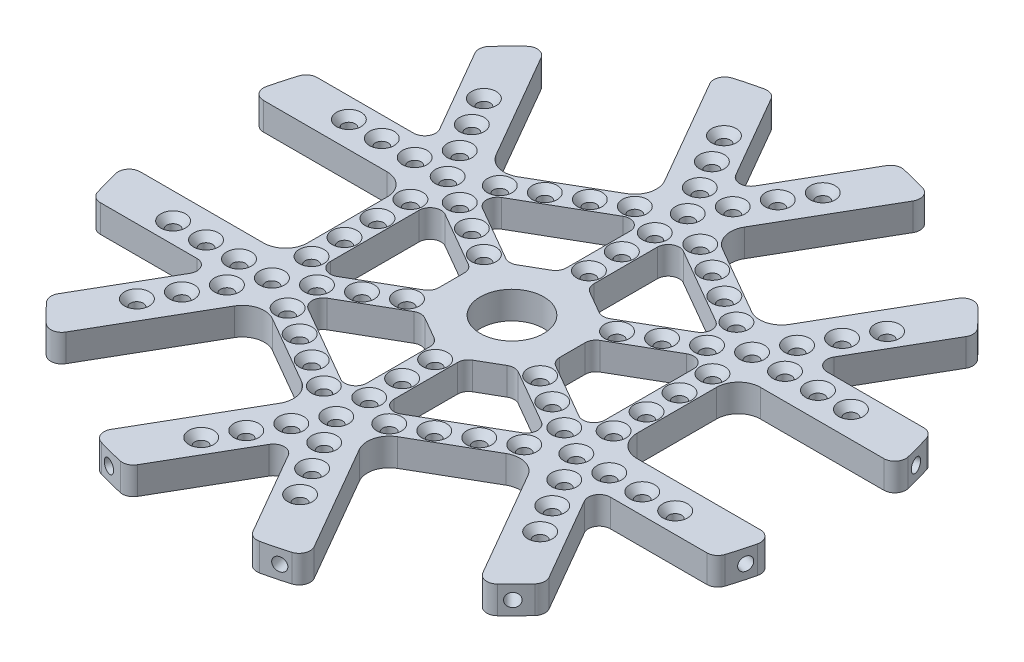
from build123d import *

# Parameters (mm, degrees)
BOSS_EXTRUDE1_DEPTH                           = 6.35
CIRPATTERN9_COUNT                             = 6
BOSS_EXTRUDE2_DEPTH                           = 6.35
SKETCH5_R                                     = 6.35
CUT_EXTRUDE1_DEPTH                            = 6.35
BOSS_EXTRUDE3_DEPTH                           = 6.35
CIRPATTERN10_COUNT                            = 6
CUT_EXTRUDE3_DEPTH                            = 7.62
FILLET5_R                                     = 2.54
FILLET6_R                                     = 5.08
CSK_FOR_4_FLAT_HEAD_MACHINE_SCREW1_AT_2_COUNT = 2
CSK_FOR_4_FLAT_HEAD_MACHINE_SCREW1_AT_2_PITCH = 7.620000000000001
CSK_FOR_4_FLAT_HEAD_MACHINE_SCREW1_AT_3_COUNT = 2
CSK_FOR_4_FLAT_HEAD_MACHINE_SCREW1_AT_3_PITCH = 15.240000000000006
CSK_FOR_4_FLAT_HEAD_MACHINE_SCREW1_AT_4_COUNT = 2
CSK_FOR_4_FLAT_HEAD_MACHINE_SCREW1_AT_4_PITCH = 22.860000000000003
CIRPATTERN11_COUNT                            = 6
CSK_FOR_4_FLAT_HEAD_MACHINE_SCREW2_AT_2_COUNT = 2
CSK_FOR_4_FLAT_HEAD_MACHINE_SCREW2_AT_2_PITCH = 15.240000000000002
CSK_FOR_4_FLAT_HEAD_MACHINE_SCREW2_AT_3_COUNT = 2
CSK_FOR_4_FLAT_HEAD_MACHINE_SCREW2_AT_3_PITCH = 7.6200000000000045
CIRPATTERN12_COUNT                            = 6
CSK_FOR_4_FLAT_HEAD_MACHINE_SCREW3_AT_2_COUNT = 2
CSK_FOR_4_FLAT_HEAD_MACHINE_SCREW3_AT_2_PITCH = 7.6199999999999966
CSK_FOR_4_FLAT_HEAD_MACHINE_SCREW3_AT_3_COUNT = 2
CSK_FOR_4_FLAT_HEAD_MACHINE_SCREW3_AT_3_PITCH = 15.239999999999997
CSK_FOR_4_FLAT_HEAD_MACHINE_SCREW3_AT_4_COUNT = 2
CSK_FOR_4_FLAT_HEAD_MACHINE_SCREW3_AT_4_PITCH = 22.859999999999996
CIRPATTERN13_COUNT                            = 6
SKETCH30_R                                    = 6.35
BOSS_EXTRUDE4_DEPTH                           = 6.35
F_9_16_CLEARANCE_HOLE1_D                      = 14.68374
CIRPATTERN14_COUNT                            = 12


with BuildPart() as part:
    # Sketch1 → Boss-Extrude1 (new body)
    with BuildSketch(Plane(origin=(0, 0, 0), x_dir=(1, 0, 0), z_dir=(0, 1, 0))):
        with BuildLine():
            Line((0, 50.13282258762273), (-14.27141129381163, 74.85163204421708))
            ThreePointArc((-14.27141129381163, 74.8516320442171), (-19.722011236812126, 73.60354796322702), (-25.066411293811605, 71.95912051192309))
            Line((-25.066411293811612, 71.95912051192312), (-3.1750000000000043, 34.04208390165379))
            Line((-3.175, 34.04208390165379), (-3.175, -3.9e-16))
            Line((-3.175, -3.9e-16), (0, 0))
            Line((0, 0), (2e-16, 50.13282258762273))
        make_face()
    boss_extrude1 = extrude(amount=BOSS_EXTRUDE1_DEPTH)

    # Mirror1: Boss-Extrude1 across Right Plane
    add(boss_extrude1.mirror(Plane(origin=(0, 0, 0), x_dir=(0, 0, -1), z_dir=(1, 0, 0))))


with BuildPart() as cirpattern9_1:
    # CirPattern9: pattern copy
    add(part.part.rotate(Axis((4.3e-16, 0, 8.8e-16), (0, 1, 0)), 1 * 360 / CIRPATTERN9_COUNT))


with BuildPart() as cirpattern9_2:
    # CirPattern9: pattern copy
    add(part.part.rotate(Axis((4.3e-16, 0, 8.8e-16), (0, 1, 0)), 2 * 360 / CIRPATTERN9_COUNT))


with BuildPart() as cirpattern9_3:
    # CirPattern9: pattern copy
    add(part.part.rotate(Axis((4.3e-16, 0, 8.8e-16), (0, 1, 0)), 3 * 360 / CIRPATTERN9_COUNT))


with BuildPart() as cirpattern9_4:
    # CirPattern9: pattern copy
    add(part.part.rotate(Axis((4.3e-16, 0, 8.8e-16), (0, 1, 0)), 4 * 360 / CIRPATTERN9_COUNT))


with BuildPart() as cirpattern9_5:
    # CirPattern9: pattern copy
    add(part.part.rotate(Axis((4.3e-16, 0, 8.8e-16), (0, 1, 0)), 5 * 360 / CIRPATTERN9_COUNT))


with BuildPart() as part_1:
    add(part.part)

    add(cirpattern9_1.part)  # Boss-Extrude2 merges CirPattern9_1

    add(cirpattern9_2.part)  # Boss-Extrude2 merges CirPattern9_2

    add(cirpattern9_3.part)  # Boss-Extrude2 merges CirPattern9_3

    add(cirpattern9_4.part)  # Boss-Extrude2 merges CirPattern9_4

    add(cirpattern9_5.part)  # Boss-Extrude2 merges CirPattern9_5
    # Sketch4 → Boss-Extrude2 (add)
    with BuildSketch(Plane(origin=(0, 6.35, 0), x_dir=(1, 0, 0), z_dir=(0, 1, 0))):
        Polygon((1.73e-15, 16.131166521158146), (-13.97, 8.065583260579077), (-13.97, -8.06558326057907), (-1.36e-15, -16.131166521158146), (13.97, -8.065583260579077), (13.97, 8.065583260579075), align=None)
    extrude(amount=-BOSS_EXTRUDE2_DEPTH)

    # Sketch5 → Cut-Extrude1 (cut)
    with BuildSketch(Plane(origin=(0, 6.35, 0), x_dir=(1, 0, 0), z_dir=(0, 1, 0))):
        with Locations(Location((0, 0, 0), (0, 0, 270))):
            Circle(SKETCH5_R)
    extrude(amount=-CUT_EXTRUDE1_DEPTH, mode=Mode.SUBTRACT)

    # Sketch6 → Boss-Extrude3 (add)
    with BuildSketch(Plane(origin=(0, 6.35, 0), x_dir=(1, 0, 0), z_dir=(0, 1, 0))):
        Polygon((-28.794525284181248, 20.037215169531706), (-2.9554747158184353, 34.95539797078033), (-6.130474715818436, 40.45465928481152), (-31.969525284181252, 25.536476483562886), align=None)
    boss_extrude3 = extrude(amount=-BOSS_EXTRUDE3_DEPTH)

    # CirPattern10: Boss-Extrude3 ×6 about axis
    cirpattern10_axis = Axis((-1.9e-16, 0, 3.67e-15), (0, 1, 0))
    for i in range(1, CIRPATTERN10_COUNT):
        add(boss_extrude3.rotate(cirpattern10_axis, i * 360 / CIRPATTERN10_COUNT))

    # Sketch46 → Cut-Extrude3 (cut)
    with BuildSketch(Plane(origin=(0, 6.35, 0), x_dir=(1, 0, 0), z_dir=(0, 1, 0))):
        Polygon((3.1750000000000007, -34.828654988864194), (3.515595271703276, -34.63201221706159), (3.1750000000000007, -34.04208390165378), align=None)
        Polygon((-3.515595271703276, -34.63201221706159), (-3.1750000000000007, -34.04208390165378), (-3.1750000000000007, -34.828654988864194), align=None)
        Polygon((-31.06880945659349, -14.271411293811216), (-31.75000000000005, -14.664696837416422), (-31.75000000000005, -14.271411293811223), align=None)
        Polygon((-28.234404728296788, -20.360600923250217), (-27.893809456593498, -19.77067260784241), (-28.575000000000067, -20.163958151447616), align=None)
        Polygon((-27.893809456593367, 19.77067260784262), (-28.57499999999993, 20.16395815144783), (-28.234404728296653, 20.360600923250427), align=None)
        Polygon((-31.749999999999957, 14.271411293811457), (-31.068809456593392, 14.271411293811445), (-31.74999999999995, 14.664696837416654), align=None)
        Polygon((3.1750000000002383, 34.042083901653776), (3.175000000000244, 34.82865498886419), (3.515595271703518, 34.63201221706158), align=None)
        Polygon((-3.515595271703034, 34.632012217061636), (-3.174999999999763, 34.04208390165382), (-3.1749999999997573, 34.82865498886423), align=None)
        Polygon((31.068809456593584, 14.271411293811008), (31.750000000000153, 14.664696837416207), (31.750000000000153, 14.271411293811012), align=None)
        Polygon((28.23440472829693, 20.36060092325003), (27.893809456593637, 19.770672607842226), (28.575000000000202, 20.163958151447424), align=None)
        Polygon((27.893809456593225, -19.7706726078428), (28.574999999999783, -20.163958151448018), (28.234404728296504, -20.360600923250615), align=None)
        Polygon((31.749999999999854, -14.271411293811669), (31.06880945659329, -14.271411293811651), (31.749999999999847, -14.664696837416864), align=None)
    extrude(amount=-CUT_EXTRUDE3_DEPTH, mode=Mode.SUBTRACT)

    # Fillet5
    fillet5_edges = [part_1.edges().sort_by_distance(p)[0] for p in [
        (10.794999999999996, 3.175, 9.898670365256137),
        (1e-16, 3.175, -50.13282258762273),
        (43.416297924299585, 3.175, 25.066411293811385),
        (71.95912051192313, 3.175, 25.066411293811576),
        (74.85163204421708, 3.175, 14.271411293811576),
        (13.969999999999999, 3.175, 4.399409051224957),
        (57.68770921811149, 3.175, 49.78522075040559),
        (-25.06641129381161, 3.175, -71.9591205119231),
        (49.78522075040546, 3.175, 57.687709218111586),
        (-14.27141129381163, 3.175, -74.8516320442171),
        (-3.174999999999999, 3.175, 14.298079416481082),
        (-5.37e-15, 3.175, 50.13282258762273),
        (14.27141129381162, 3.175, 74.8516320442171),
        (25.0664112938116, 3.175, 71.9591205119231),
        (3.1749999999999994, 3.175, 14.298079416481082),
        (-14.271411293811639, 3.175, 74.8516320442171),
        (-25.066411293811615, 3.175, 71.9591205119231),
        (-13.969999999999999, 3.175, 4.399409051224946),
        (-43.4162979242996, 3.175, 25.066411293811353),
        (-57.68770921811153, 3.175, 49.78522075040555),
        (-49.78522075040549, 3.175, 57.68770921811155),
        (-10.794999999999998, 3.175, 9.898670365256132),
        (-71.95912051192315, 3.175, 25.06641129381152),
        (-74.8516320442171, 3.175, 14.271411293811527),
        (-10.795000000000002, 3.175, -9.898670365256137),
        (-43.4162979242996, 3.175, -25.06641129381137),
        (-71.95912051192316, 3.175, -25.06641129381154),
        (-74.8516320442171, 3.175, -14.27141129381155),
        (-13.969999999999999, 3.175, -4.399409051224949),
        (-57.68770921811152, 3.175, -49.78522075040557),
        (-49.78522075040548, 3.175, -57.687709218111564),
        (14.27141129381163, 3.175, -74.8516320442171),
        (25.06641129381161, 3.175, -71.9591205119231),
        (-3.1750000000000007, 3.175, 34.828654988864194),
        (3.1750000000000007, 3.175, 34.828654988864194),
        (3.1749999999999976, 3.175, -14.298079416481084),
        (28.574999999999783, 3.175, 20.163958151448018),
        (-3.1750000000000007, 3.175, -14.298079416481082),
        (31.749999999999847, 3.175, 14.664696837416864),
        (31.750000000000153, 3.175, -14.664696837416207),
        (28.575000000000202, 3.175, -20.163958151447424),
        (3.175000000000244, 3.175, -34.82865498886419),
        (-3.1749999999997573, 3.175, -34.82865498886423),
        (-28.57499999999993, 3.175, -20.16395815144783),
        (-31.74999999999995, 3.175, -14.664696837416654),
        (-31.75000000000005, 3.175, 14.664696837416422),
        (-28.575000000000067, 3.175, 20.163958151447616),
        (13.969999999999999, 3.175, -4.39940905122495),
        (10.794999999999998, 3.175, -9.898670365256136),
        (43.4162979242996, 3.175, -25.06641129381137),
        (57.68770921811152, 3.175, -49.78522075040557),
        (49.78522075040548, 3.175, -57.687709218111564),
        (71.95912051192316, 3.175, -25.06641129381154),
        (74.8516320442171, 3.175, -14.27141129381155),
    ]]
    fillet(fillet5_edges, radius=FILLET5_R)

    # Fillet6
    fillet6_edges = [part_1.edges().sort_by_distance(p)[0] for p in [
        (-31.40940472829675, 3.175, -25.85986223728143),
        (-6.690595271703234, 3.175, -40.13127353109277),
        (-38.1, 3.175, -14.271411293811342),
        (-38.099999999999994, 3.175, 14.27141129381133),
        (-31.409404728296764, 3.175, 25.859862237281444),
        (-6.690595271703227, 3.175, 40.13127353109277),
        (6.690595271703243, 3.175, 40.13127353109279),
        (31.409404728296746, 3.175, 25.859862237281455),
        (38.099999999999994, 3.175, 14.271411293811354),
        (38.099999999999994, 3.175, -14.271411293811342),
        (31.409404728296753, 3.175, -25.859862237281448),
        (6.690595271703236, 3.175, -40.13127353109277),
    ]]
    fillet(fillet6_edges, radius=FILLET6_R)

    # Sketch23 → CSK for #4 Flat Head Machine Screw1 (revolve, cut)
    with BuildSketch(Plane(origin=(0, 6.35, -17.779999999999998), x_dir=(0, 0, 1), z_dir=(1, 0, 0))):
        Polygon((0, 0), (-2.08e-15, 8.505187863951393), (1.473199999999987, 7.620000000000002), (1.473199999999999, 1.592454986116043), (2.857499999999999, -1.73e-15), align=None)
    csk_for_4_flat_head_machine_screw1 = revolve(axis=Axis((0, 12.69999999999999, -17.779999999999998), (0, -1, 0)), mode=Mode.SUBTRACT)

    # CSK for #4 Flat Head Machine Screw1 at 2: CSK for #4 Flat Head Machine Screw1 ×2
    with Locations(*[(0, 0, -i * CSK_FOR_4_FLAT_HEAD_MACHINE_SCREW1_AT_2_PITCH) for i in range(1, CSK_FOR_4_FLAT_HEAD_MACHINE_SCREW1_AT_2_COUNT)]):
        add(csk_for_4_flat_head_machine_screw1, mode=Mode.SUBTRACT)

    # CSK for #4 Flat Head Machine Screw1 at 3: CSK for #4 Flat Head Machine Screw1 ×2
    with Locations(*[(0, 0, -i * CSK_FOR_4_FLAT_HEAD_MACHINE_SCREW1_AT_3_PITCH) for i in range(1, CSK_FOR_4_FLAT_HEAD_MACHINE_SCREW1_AT_3_COUNT)]):
        add(csk_for_4_flat_head_machine_screw1, mode=Mode.SUBTRACT)

    # CSK for #4 Flat Head Machine Screw1 at 4: CSK for #4 Flat Head Machine Screw1 ×2
    with Locations(*[(0, 0, -i * CSK_FOR_4_FLAT_HEAD_MACHINE_SCREW1_AT_4_PITCH) for i in range(1, CSK_FOR_4_FLAT_HEAD_MACHINE_SCREW1_AT_4_COUNT)]):
        add(csk_for_4_flat_head_machine_screw1, mode=Mode.SUBTRACT)

    # CirPattern11: CSK for #4 Flat Head Machine Screw1 ×6 about axis
    cirpattern11_axis = Axis((-3.467e-14, 0, 8.3e-16), (0, 1, 0))
    for i in range(1, CIRPATTERN11_COUNT):
        add(csk_for_4_flat_head_machine_screw1.rotate(cirpattern11_axis, i * 360 / CIRPATTERN11_COUNT), mode=Mode.SUBTRACT)

    # CirPattern11 copy 1 sketch → CirPattern11 copy 1 (revolve, cut)
    with BuildSketch(Plane(origin=(-21.997045256124757, 6.35, -12.700000000000031), x_dir=(0.8660254037844386, 0, 0.5000000000000001), z_dir=(0.5000000000000001, 0, -0.8660254037844386))):
        Polygon((0, 0), (-2.08e-15, 8.505187863951393), (1.473199999999987, 7.620000000000002), (1.473199999999999, 1.592454986116043), (2.857499999999999, -1.73e-15), align=None)
    revolve(axis=Axis((-21.997045256124757, 12.69999999999999, -12.700000000000031), (0, -1, 0)), mode=Mode.SUBTRACT)

    # CirPattern11 copy 2 sketch → CirPattern11 copy 2 (revolve, cut)
    with BuildSketch(Plane(origin=(-21.997045256124792, 6.35, 12.699999999999966), x_dir=(0.8660254037844387, 0, -0.4999999999999998), z_dir=(-0.4999999999999998, 0, -0.8660254037844387))):
        Polygon((0, 0), (-2.08e-15, 8.505187863951393), (1.473199999999987, 7.620000000000002), (1.473199999999999, 1.592454986116043), (2.857499999999999, -1.73e-15), align=None)
    revolve(axis=Axis((-21.997045256124792, 12.69999999999999, 12.699999999999966), (0, -1, 0)), mode=Mode.SUBTRACT)

    # CirPattern11 copy 3 sketch → CirPattern11 copy 3 (revolve, cut)
    with BuildSketch(Plane(origin=(-7.246e-14, 6.35, 25.4), x_dir=(1.2e-16, 0, -1), z_dir=(-1, 0, -1.2e-16))):
        Polygon((0, 0), (-2.08e-15, 8.505187863951393), (1.473199999999987, 7.620000000000002), (1.473199999999999, 1.592454986116043), (2.857499999999999, -1.73e-15), align=None)
    revolve(axis=Axis((-7.246e-14, 12.69999999999999, 25.4), (0, -1, 0)), mode=Mode.SUBTRACT)

    # CirPattern11 copy 4 sketch → CirPattern11 copy 4 (revolve, cut)
    with BuildSketch(Plane(origin=(21.997045256124682, 6.35, 12.700000000000042), x_dir=(-0.8660254037844384, 0, -0.5000000000000004), z_dir=(-0.5000000000000004, 0, 0.8660254037844384))):
        Polygon((0, 0), (-2.08e-15, 8.505187863951393), (1.473199999999987, 7.620000000000002), (1.473199999999999, 1.592454986116043), (2.857499999999999, -1.73e-15), align=None)
    revolve(axis=Axis((21.997045256124682, 12.69999999999999, 12.700000000000042), (0, -1, 0)), mode=Mode.SUBTRACT)

    # CirPattern11 copy 5 sketch → CirPattern11 copy 5 (revolve, cut)
    with BuildSketch(Plane(origin=(21.99704525612472, 6.35, -12.69999999999997), x_dir=(-0.8660254037844386, 0, 0.5000000000000001), z_dir=(0.5000000000000001, 0, 0.8660254037844386))):
        Polygon((0, 0), (-2.08e-15, 8.505187863951393), (1.473199999999987, 7.620000000000002), (1.473199999999999, 1.592454986116043), (2.857499999999999, -1.73e-15), align=None)
    revolve(axis=Axis((21.99704525612472, 12.69999999999999, -12.69999999999997), (0, -1, 0)), mode=Mode.SUBTRACT)

    # CirPattern11 copy 6 sketch → CirPattern11 copy 6 (revolve, cut)
    with BuildSketch(Plane(origin=(-28.596158832962182, 6.35, -16.510000000000034), x_dir=(0.8660254037844386, 0, 0.5000000000000001), z_dir=(0.5000000000000001, 0, -0.8660254037844386))):
        Polygon((0, 0), (-2.08e-15, 8.505187863951393), (1.473199999999987, 7.620000000000002), (1.473199999999999, 1.592454986116043), (2.857499999999999, -1.73e-15), align=None)
    revolve(axis=Axis((-28.596158832962182, 12.69999999999999, -16.510000000000034), (0, -1, 0)), mode=Mode.SUBTRACT)

    # CirPattern11 copy 7 sketch → CirPattern11 copy 7 (revolve, cut)
    with BuildSketch(Plane(origin=(-28.59615883296222, 6.35, 16.509999999999966), x_dir=(0.8660254037844387, 0, -0.4999999999999998), z_dir=(-0.4999999999999998, 0, -0.8660254037844387))):
        Polygon((0, 0), (-2.08e-15, 8.505187863951393), (1.473199999999987, 7.620000000000002), (1.473199999999999, 1.592454986116043), (2.857499999999999, -1.73e-15), align=None)
    revolve(axis=Axis((-28.59615883296222, 12.69999999999999, 16.509999999999966), (0, -1, 0)), mode=Mode.SUBTRACT)

    # CirPattern11 copy 8 sketch → CirPattern11 copy 8 (revolve, cut)
    with BuildSketch(Plane(origin=(-7.339e-14, 6.35, 33.02), x_dir=(1.2e-16, 0, -1), z_dir=(-1, 0, -1.2e-16))):
        Polygon((0, 0), (-2.08e-15, 8.505187863951393), (1.473199999999987, 7.620000000000002), (1.473199999999999, 1.592454986116043), (2.857499999999999, -1.73e-15), align=None)
    revolve(axis=Axis((-7.339e-14, 12.69999999999999, 33.02), (0, -1, 0)), mode=Mode.SUBTRACT)

    # CirPattern11 copy 9 sketch → CirPattern11 copy 9 (revolve, cut)
    with BuildSketch(Plane(origin=(28.596158832962107, 6.35, 16.510000000000048), x_dir=(-0.8660254037844384, 0, -0.5000000000000004), z_dir=(-0.5000000000000004, 0, 0.8660254037844384))):
        Polygon((0, 0), (-2.08e-15, 8.505187863951393), (1.473199999999987, 7.620000000000002), (1.473199999999999, 1.592454986116043), (2.857499999999999, -1.73e-15), align=None)
    revolve(axis=Axis((28.596158832962107, 12.69999999999999, 16.510000000000048), (0, -1, 0)), mode=Mode.SUBTRACT)

    # CirPattern11 copy 10 sketch → CirPattern11 copy 10 (revolve, cut)
    with BuildSketch(Plane(origin=(28.59615883296215, 6.35, -16.509999999999977), x_dir=(-0.8660254037844386, 0, 0.5000000000000001), z_dir=(0.5000000000000001, 0, 0.8660254037844386))):
        Polygon((0, 0), (-2.08e-15, 8.505187863951393), (1.473199999999987, 7.620000000000002), (1.473199999999999, 1.592454986116043), (2.857499999999999, -1.73e-15), align=None)
    revolve(axis=Axis((28.59615883296215, 12.69999999999999, -16.509999999999977), (0, -1, 0)), mode=Mode.SUBTRACT)

    # CirPattern11 copy 11 sketch → CirPattern11 copy 11 (revolve, cut)
    with BuildSketch(Plane(origin=(-35.1952724097996, 6.35, -20.320000000000036), x_dir=(0.8660254037844386, 0, 0.5000000000000001), z_dir=(0.5000000000000001, 0, -0.8660254037844386))):
        Polygon((0, 0), (-2.08e-15, 8.505187863951393), (1.473199999999987, 7.620000000000002), (1.473199999999999, 1.592454986116043), (2.857499999999999, -1.73e-15), align=None)
    revolve(axis=Axis((-35.1952724097996, 12.69999999999999, -20.320000000000036), (0, -1, 0)), mode=Mode.SUBTRACT)

    # CirPattern11 copy 12 sketch → CirPattern11 copy 12 (revolve, cut)
    with BuildSketch(Plane(origin=(-35.19527240979964, 6.35, 20.319999999999965), x_dir=(0.8660254037844387, 0, -0.4999999999999998), z_dir=(-0.4999999999999998, 0, -0.8660254037844387))):
        Polygon((0, 0), (-2.08e-15, 8.505187863951393), (1.473199999999987, 7.620000000000002), (1.473199999999999, 1.592454986116043), (2.857499999999999, -1.73e-15), align=None)
    revolve(axis=Axis((-35.19527240979964, 12.69999999999999, 20.319999999999965), (0, -1, 0)), mode=Mode.SUBTRACT)

    # CirPattern11 copy 13 sketch → CirPattern11 copy 13 (revolve, cut)
    with BuildSketch(Plane(origin=(-7.433e-14, 6.35, 40.64), x_dir=(1.2e-16, 0, -1), z_dir=(-1, 0, -1.2e-16))):
        Polygon((0, 0), (-2.08e-15, 8.505187863951393), (1.473199999999987, 7.620000000000002), (1.473199999999999, 1.592454986116043), (2.857499999999999, -1.73e-15), align=None)
    revolve(axis=Axis((-7.433e-14, 12.69999999999999, 40.64), (0, -1, 0)), mode=Mode.SUBTRACT)

    # CirPattern11 copy 14 sketch → CirPattern11 copy 14 (revolve, cut)
    with BuildSketch(Plane(origin=(35.19527240979953, 6.35, 20.32000000000005), x_dir=(-0.8660254037844384, 0, -0.5000000000000004), z_dir=(-0.5000000000000004, 0, 0.8660254037844384))):
        Polygon((0, 0), (-2.08e-15, 8.505187863951393), (1.473199999999987, 7.620000000000002), (1.473199999999999, 1.592454986116043), (2.857499999999999, -1.73e-15), align=None)
    revolve(axis=Axis((35.19527240979953, 12.69999999999999, 20.32000000000005), (0, -1, 0)), mode=Mode.SUBTRACT)

    # CirPattern11 copy 15 sketch → CirPattern11 copy 15 (revolve, cut)
    with BuildSketch(Plane(origin=(35.195272409799564, 6.35, -20.319999999999972), x_dir=(-0.8660254037844386, 0, 0.5000000000000001), z_dir=(0.5000000000000001, 0, 0.8660254037844386))):
        Polygon((0, 0), (-2.08e-15, 8.505187863951393), (1.473199999999987, 7.620000000000002), (1.473199999999999, 1.592454986116043), (2.857499999999999, -1.73e-15), align=None)
    revolve(axis=Axis((35.195272409799564, 12.69999999999999, -20.319999999999972), (0, -1, 0)), mode=Mode.SUBTRACT)

    # Sketch26 → CSK for #4 Flat Head Machine Screw2 (revolve, cut)
    with BuildSketch(Plane(origin=(-58.05527240979951, 6.35, 20.320000000000167), x_dir=(0, 0, 1), z_dir=(1, 0, 0))):
        Polygon((0, 0), (-2.08e-15, 8.5051878639514), (1.473199999999987, 7.620000000000002), (1.4731999999999887, 1.592454986116043), (2.857499999999999, -1.73e-15), align=None)
    csk_for_4_flat_head_machine_screw2 = revolve(axis=Axis((-58.05527240979951, 12.69999999999999, 20.320000000000167), (0, -1, 0)), mode=Mode.SUBTRACT)

    # CSK for #4 Flat Head Machine Screw2 at 2: CSK for #4 Flat Head Machine Screw2 ×2
    with Locations(*[(i * CSK_FOR_4_FLAT_HEAD_MACHINE_SCREW2_AT_2_PITCH, 0, 0) for i in range(1, CSK_FOR_4_FLAT_HEAD_MACHINE_SCREW2_AT_2_COUNT)]):
        add(csk_for_4_flat_head_machine_screw2, mode=Mode.SUBTRACT)

    # CSK for #4 Flat Head Machine Screw2 at 3: CSK for #4 Flat Head Machine Screw2 ×2
    with Locations(*[(i * CSK_FOR_4_FLAT_HEAD_MACHINE_SCREW2_AT_3_PITCH, 0, 0) for i in range(1, CSK_FOR_4_FLAT_HEAD_MACHINE_SCREW2_AT_3_COUNT)]):
        add(csk_for_4_flat_head_machine_screw2, mode=Mode.SUBTRACT)

    # Mirror2: CSK for #4 Flat Head Machine Screw2 across plane
    add(csk_for_4_flat_head_machine_screw2.mirror(Plane(origin=(0, 0, 0), x_dir=(0, 0, 1), z_dir=(1, 0, 0))), mode=Mode.SUBTRACT)

    # Mirror2 copy 1 sketch → Mirror2 copy 1 (revolve, cut)
    with BuildSketch(Plane(origin=(42.815272409799505, 6.35, 20.320000000000167), x_dir=(0, 0, 1), z_dir=(-1, 0, 0))):
        Polygon((0, 0), (-2.08e-15, -8.5051878639514), (1.473199999999987, -7.620000000000002), (1.4731999999999887, -1.592454986116043), (2.857499999999999, 1.73e-15), align=None)
    revolve(axis=Axis((42.815272409799505, 12.69999999999999, 20.320000000000167), (0, 1, 0)), mode=Mode.SUBTRACT)

    # Mirror2 copy 2 sketch → Mirror2 copy 2 (revolve, cut)
    with BuildSketch(Plane(origin=(50.4352724097995, 6.35, 20.320000000000167), x_dir=(0, 0, 1), z_dir=(-1, 0, 0))):
        Polygon((0, 0), (-2.08e-15, -8.5051878639514), (1.473199999999987, -7.620000000000002), (1.4731999999999887, -1.592454986116043), (2.857499999999999, 1.73e-15), align=None)
    revolve(axis=Axis((50.4352724097995, 12.69999999999999, 20.320000000000167), (0, 1, 0)), mode=Mode.SUBTRACT)

    # CirPattern12: CSK for #4 Flat Head Machine Screw2 ×6 about axis
    cirpattern12_axis = Axis((2.37e-14, 0, -1.01e-15), (0, 1, 0))
    for i in range(1, CIRPATTERN12_COUNT):
        add(csk_for_4_flat_head_machine_screw2.rotate(cirpattern12_axis, i * 360 / CIRPATTERN12_COUNT), mode=Mode.SUBTRACT)

    # CirPattern12 copy 1 sketch → CirPattern12 copy 1 (revolve, cut)
    with BuildSketch(Plane(origin=(-3.809999999999807, 6.35, 47.23911357683745), x_dir=(0.8660254037844386, 0, 0.5000000000000001), z_dir=(0.5000000000000001, 0, -0.8660254037844386))):
        Polygon((0, 0), (-2.08e-15, 8.5051878639514), (1.473199999999987, 7.620000000000002), (1.4731999999999887, 1.592454986116043), (2.857499999999999, -1.73e-15), align=None)
    revolve(axis=Axis((-3.809999999999807, 12.69999999999999, 47.23911357683745), (0, -1, 0)), mode=Mode.SUBTRACT)

    # CirPattern12 copy 2 sketch → CirPattern12 copy 2 (revolve, cut)
    with BuildSketch(Plane(origin=(39.005272409799716, 6.35, 26.919113576837297), x_dir=(0.8660254037844387, 0, -0.4999999999999998), z_dir=(-0.4999999999999998, 0, -0.8660254037844387))):
        Polygon((0, 0), (-2.08e-15, 8.5051878639514), (1.473199999999987, 7.620000000000002), (1.4731999999999887, 1.592454986116043), (2.857499999999999, -1.73e-15), align=None)
    revolve(axis=Axis((39.005272409799716, 12.69999999999999, 26.919113576837297), (0, -1, 0)), mode=Mode.SUBTRACT)

    # CirPattern12 copy 3 sketch → CirPattern12 copy 3 (revolve, cut)
    with BuildSketch(Plane(origin=(42.815272409799555, 6.35, -20.320000000000164), x_dir=(1.2e-16, 0, -1), z_dir=(-1, 0, -1.2e-16))):
        Polygon((0, 0), (-2.08e-15, 8.5051878639514), (1.473199999999987, 7.620000000000002), (1.4731999999999887, 1.592454986116043), (2.857499999999999, -1.73e-15), align=None)
    revolve(axis=Axis((42.815272409799555, 12.69999999999999, -20.320000000000164), (0, -1, 0)), mode=Mode.SUBTRACT)

    # CirPattern12 copy 4 sketch → CirPattern12 copy 4 (revolve, cut)
    with BuildSketch(Plane(origin=(3.8099999999998735, 6.35, -47.239113576837454), x_dir=(-0.8660254037844384, 0, -0.5000000000000004), z_dir=(-0.5000000000000004, 0, 0.8660254037844384))):
        Polygon((0, 0), (-2.08e-15, 8.5051878639514), (1.473199999999987, 7.620000000000002), (1.4731999999999887, 1.592454986116043), (2.857499999999999, -1.73e-15), align=None)
    revolve(axis=Axis((3.8099999999998735, 12.69999999999999, -47.239113576837454), (0, -1, 0)), mode=Mode.SUBTRACT)

    # CirPattern12 copy 5 sketch → CirPattern12 copy 5 (revolve, cut)
    with BuildSketch(Plane(origin=(-39.00527240979969, 6.35, -26.919113576837287), x_dir=(-0.8660254037844386, 0, 0.5000000000000001), z_dir=(0.5000000000000001, 0, 0.8660254037844386))):
        Polygon((0, 0), (-2.08e-15, 8.5051878639514), (1.473199999999987, 7.620000000000002), (1.4731999999999887, 1.592454986116043), (2.857499999999999, -1.73e-15), align=None)
    revolve(axis=Axis((-39.00527240979969, 12.69999999999999, -26.919113576837287), (0, -1, 0)), mode=Mode.SUBTRACT)

    # CirPattern12 copy 6 sketch → CirPattern12 copy 6 (revolve, cut)
    with BuildSketch(Plane(origin=(-7.619999999999806, 6.35, 53.83822715367487), x_dir=(0.8660254037844386, 0, 0.5000000000000001), z_dir=(0.5000000000000001, 0, -0.8660254037844386))):
        Polygon((0, 0), (-2.08e-15, 8.5051878639514), (1.473199999999987, 7.620000000000002), (1.4731999999999887, 1.592454986116043), (2.857499999999999, -1.73e-15), align=None)
    revolve(axis=Axis((-7.619999999999806, 12.69999999999999, 53.83822715367487), (0, -1, 0)), mode=Mode.SUBTRACT)

    # CirPattern12 copy 7 sketch → CirPattern12 copy 7 (revolve, cut)
    with BuildSketch(Plane(origin=(42.81527240979971, 6.35, 33.518227153674715), x_dir=(0.8660254037844387, 0, -0.4999999999999998), z_dir=(-0.4999999999999998, 0, -0.8660254037844387))):
        Polygon((0, 0), (-2.08e-15, 8.5051878639514), (1.473199999999987, 7.620000000000002), (1.4731999999999887, 1.592454986116043), (2.857499999999999, -1.73e-15), align=None)
    revolve(axis=Axis((42.81527240979971, 12.69999999999999, 33.518227153674715), (0, -1, 0)), mode=Mode.SUBTRACT)

    # CirPattern12 copy 8 sketch → CirPattern12 copy 8 (revolve, cut)
    with BuildSketch(Plane(origin=(50.43527240979955, 6.35, -20.320000000000164), x_dir=(1.2e-16, 0, -1), z_dir=(-1, 0, -1.2e-16))):
        Polygon((0, 0), (-2.08e-15, 8.5051878639514), (1.473199999999987, 7.620000000000002), (1.4731999999999887, 1.592454986116043), (2.857499999999999, -1.73e-15), align=None)
    revolve(axis=Axis((50.43527240979955, 12.69999999999999, -20.320000000000164), (0, -1, 0)), mode=Mode.SUBTRACT)

    # CirPattern12 copy 9 sketch → CirPattern12 copy 9 (revolve, cut)
    with BuildSketch(Plane(origin=(7.619999999999876, 6.35, -53.83822715367487), x_dir=(-0.8660254037844384, 0, -0.5000000000000004), z_dir=(-0.5000000000000004, 0, 0.8660254037844384))):
        Polygon((0, 0), (-2.08e-15, 8.5051878639514), (1.473199999999987, 7.620000000000002), (1.4731999999999887, 1.592454986116043), (2.857499999999999, -1.73e-15), align=None)
    revolve(axis=Axis((7.619999999999876, 12.69999999999999, -53.83822715367487), (0, -1, 0)), mode=Mode.SUBTRACT)

    # CirPattern12 copy 10 sketch → CirPattern12 copy 10 (revolve, cut)
    with BuildSketch(Plane(origin=(-42.81527240979968, 6.35, -33.51822715367471), x_dir=(-0.8660254037844386, 0, 0.5000000000000001), z_dir=(0.5000000000000001, 0, 0.8660254037844386))):
        Polygon((0, 0), (-2.08e-15, 8.5051878639514), (1.473199999999987, 7.620000000000002), (1.4731999999999887, 1.592454986116043), (2.857499999999999, -1.73e-15), align=None)
    revolve(axis=Axis((-42.81527240979968, 12.69999999999999, -33.51822715367471), (0, -1, 0)), mode=Mode.SUBTRACT)

    # CirPattern12 copy 11 sketch → CirPattern12 copy 11 (revolve, cut)
    with BuildSketch(Plane(origin=(46.62527240979971, 6.35, -40.11734073051209), x_dir=(0.8660254037844386, 0, 0.5000000000000001), z_dir=(-0.5000000000000001, 0, 0.8660254037844386))):
        Polygon((0, 0), (-2.08e-15, -8.5051878639514), (1.473199999999987, -7.620000000000002), (1.4731999999999887, -1.592454986116043), (2.857499999999999, 1.73e-15), align=None)
    revolve(axis=Axis((46.62527240979971, 12.69999999999999, -40.11734073051209), (0, 1, 0)), mode=Mode.SUBTRACT)

    # CirPattern12 copy 12 sketch → CirPattern12 copy 12 (revolve, cut)
    with BuildSketch(Plane(origin=(-11.429999999999763, 6.35, -60.437340730512254), x_dir=(0.8660254037844387, 0, -0.4999999999999998), z_dir=(0.4999999999999998, 0, 0.8660254037844387))):
        Polygon((0, 0), (-2.08e-15, -8.5051878639514), (1.473199999999987, -7.620000000000002), (1.4731999999999887, -1.592454986116043), (2.857499999999999, 1.73e-15), align=None)
    revolve(axis=Axis((-11.429999999999763, 12.69999999999999, -60.437340730512254), (0, 1, 0)), mode=Mode.SUBTRACT)

    # CirPattern12 copy 13 sketch → CirPattern12 copy 13 (revolve, cut)
    with BuildSketch(Plane(origin=(-58.05527240979946, 6.35, -20.320000000000178), x_dir=(1.2e-16, 0, -1), z_dir=(1, 0, 1.2e-16))):
        Polygon((0, 0), (-2.08e-15, -8.5051878639514), (1.473199999999987, -7.620000000000002), (1.4731999999999887, -1.592454986116043), (2.857499999999999, 1.73e-15), align=None)
    revolve(axis=Axis((-58.05527240979946, 12.69999999999999, -20.320000000000178), (0, 1, 0)), mode=Mode.SUBTRACT)

    # CirPattern12 copy 14 sketch → CirPattern12 copy 14 (revolve, cut)
    with BuildSketch(Plane(origin=(-46.62527240979967, 6.35, 40.11734073051206), x_dir=(-0.8660254037844384, 0, -0.5000000000000004), z_dir=(0.5000000000000004, 0, -0.8660254037844384))):
        Polygon((0, 0), (-2.08e-15, -8.5051878639514), (1.473199999999987, -7.620000000000002), (1.4731999999999887, -1.592454986116043), (2.857499999999999, 1.73e-15), align=None)
    revolve(axis=Axis((-46.62527240979967, 12.69999999999999, 40.11734073051206), (0, 1, 0)), mode=Mode.SUBTRACT)

    # CirPattern12 copy 15 sketch → CirPattern12 copy 15 (revolve, cut)
    with BuildSketch(Plane(origin=(11.429999999999833, 6.35, 60.437340730512254), x_dir=(-0.8660254037844386, 0, 0.5000000000000001), z_dir=(-0.5000000000000001, 0, -0.8660254037844386))):
        Polygon((0, 0), (-2.08e-15, -8.5051878639514), (1.473199999999987, -7.620000000000002), (1.4731999999999887, -1.592454986116043), (2.857499999999999, 1.73e-15), align=None)
    revolve(axis=Axis((11.429999999999833, 12.69999999999999, 60.437340730512254), (0, 1, 0)), mode=Mode.SUBTRACT)

    # CirPattern12 copy 16 sketch → CirPattern12 copy 16 (revolve, cut)
    with BuildSketch(Plane(origin=(39.00527240979971, 6.35, -26.919113576837248), x_dir=(0.8660254037844386, 0, 0.5000000000000001), z_dir=(-0.5000000000000001, 0, 0.8660254037844386))):
        Polygon((0, 0), (-2.08e-15, -8.5051878639514), (1.473199999999987, -7.620000000000002), (1.4731999999999887, -1.592454986116043), (2.857499999999999, 1.73e-15), align=None)
    revolve(axis=Axis((39.00527240979971, 12.69999999999999, -26.919113576837248), (0, 1, 0)), mode=Mode.SUBTRACT)

    # CirPattern12 copy 17 sketch → CirPattern12 copy 17 (revolve, cut)
    with BuildSketch(Plane(origin=(-3.809999999999767, 6.35, -47.23911357683741), x_dir=(0.8660254037844387, 0, -0.4999999999999998), z_dir=(0.4999999999999998, 0, 0.8660254037844387))):
        Polygon((0, 0), (-2.08e-15, -8.5051878639514), (1.473199999999987, -7.620000000000002), (1.4731999999999887, -1.592454986116043), (2.857499999999999, 1.73e-15), align=None)
    revolve(axis=Axis((-3.809999999999767, 12.69999999999999, -47.23911357683741), (0, 1, 0)), mode=Mode.SUBTRACT)

    # CirPattern12 copy 18 sketch → CirPattern12 copy 18 (revolve, cut)
    with BuildSketch(Plane(origin=(-42.815272409799455, 6.35, -20.320000000000174), x_dir=(1.2e-16, 0, -1), z_dir=(1, 0, 1.2e-16))):
        Polygon((0, 0), (-2.08e-15, -8.5051878639514), (1.473199999999987, -7.620000000000002), (1.4731999999999887, -1.592454986116043), (2.857499999999999, 1.73e-15), align=None)
    revolve(axis=Axis((-42.815272409799455, 12.69999999999999, -20.320000000000174), (0, 1, 0)), mode=Mode.SUBTRACT)

    # CirPattern12 copy 19 sketch → CirPattern12 copy 19 (revolve, cut)
    with BuildSketch(Plane(origin=(-39.005272409799666, 6.35, 26.91911357683722), x_dir=(-0.8660254037844384, 0, -0.5000000000000004), z_dir=(0.5000000000000004, 0, -0.8660254037844384))):
        Polygon((0, 0), (-2.08e-15, -8.5051878639514), (1.473199999999987, -7.620000000000002), (1.4731999999999887, -1.592454986116043), (2.857499999999999, 1.73e-15), align=None)
    revolve(axis=Axis((-39.005272409799666, 12.69999999999999, 26.91911357683722), (0, 1, 0)), mode=Mode.SUBTRACT)

    # CirPattern12 copy 20 sketch → CirPattern12 copy 20 (revolve, cut)
    with BuildSketch(Plane(origin=(3.80999999999983, 6.35, 47.23911357683741), x_dir=(-0.8660254037844386, 0, 0.5000000000000001), z_dir=(-0.5000000000000001, 0, -0.8660254037844386))):
        Polygon((0, 0), (-2.08e-15, -8.5051878639514), (1.473199999999987, -7.620000000000002), (1.4731999999999887, -1.592454986116043), (2.857499999999999, 1.73e-15), align=None)
    revolve(axis=Axis((3.80999999999983, 12.69999999999999, 47.23911357683741), (0, 1, 0)), mode=Mode.SUBTRACT)

    # CirPattern12 copy 21 sketch → CirPattern12 copy 21 (revolve, cut)
    with BuildSketch(Plane(origin=(42.81527240979971, 6.35, -33.518227153674665), x_dir=(0.8660254037844386, 0, 0.5000000000000001), z_dir=(-0.5000000000000001, 0, 0.8660254037844386))):
        Polygon((0, 0), (-2.08e-15, -8.5051878639514), (1.473199999999987, -7.620000000000002), (1.4731999999999887, -1.592454986116043), (2.857499999999999, 1.73e-15), align=None)
    revolve(axis=Axis((42.81527240979971, 12.69999999999999, -33.518227153674665), (0, 1, 0)), mode=Mode.SUBTRACT)

    # CirPattern12 copy 22 sketch → CirPattern12 copy 22 (revolve, cut)
    with BuildSketch(Plane(origin=(-7.619999999999764, 6.35, -53.83822715367483), x_dir=(0.8660254037844387, 0, -0.4999999999999998), z_dir=(0.4999999999999998, 0, 0.8660254037844387))):
        Polygon((0, 0), (-2.08e-15, -8.5051878639514), (1.473199999999987, -7.620000000000002), (1.4731999999999887, -1.592454986116043), (2.857499999999999, 1.73e-15), align=None)
    revolve(axis=Axis((-7.619999999999764, 12.69999999999999, -53.83822715367483), (0, 1, 0)), mode=Mode.SUBTRACT)

    # CirPattern12 copy 23 sketch → CirPattern12 copy 23 (revolve, cut)
    with BuildSketch(Plane(origin=(-50.43527240979945, 6.35, -20.320000000000174), x_dir=(1.2e-16, 0, -1), z_dir=(1, 0, 1.2e-16))):
        Polygon((0, 0), (-2.08e-15, -8.5051878639514), (1.473199999999987, -7.620000000000002), (1.4731999999999887, -1.592454986116043), (2.857499999999999, 1.73e-15), align=None)
    revolve(axis=Axis((-50.43527240979945, 12.69999999999999, -20.320000000000174), (0, 1, 0)), mode=Mode.SUBTRACT)

    # CirPattern12 copy 24 sketch → CirPattern12 copy 24 (revolve, cut)
    with BuildSketch(Plane(origin=(-42.81527240979967, 6.35, 33.51822715367464), x_dir=(-0.8660254037844384, 0, -0.5000000000000004), z_dir=(0.5000000000000004, 0, -0.8660254037844384))):
        Polygon((0, 0), (-2.08e-15, -8.5051878639514), (1.473199999999987, -7.620000000000002), (1.4731999999999887, -1.592454986116043), (2.857499999999999, 1.73e-15), align=None)
    revolve(axis=Axis((-42.81527240979967, 12.69999999999999, 33.51822715367464), (0, 1, 0)), mode=Mode.SUBTRACT)

    # CirPattern12 copy 25 sketch → CirPattern12 copy 25 (revolve, cut)
    with BuildSketch(Plane(origin=(7.6199999999998305, 6.35, 53.83822715367483), x_dir=(-0.8660254037844386, 0, 0.5000000000000001), z_dir=(-0.5000000000000001, 0, -0.8660254037844386))):
        Polygon((0, 0), (-2.08e-15, -8.5051878639514), (1.473199999999987, -7.620000000000002), (1.4731999999999887, -1.592454986116043), (2.857499999999999, 1.73e-15), align=None)
    revolve(axis=Axis((7.6199999999998305, 12.69999999999999, 53.83822715367483), (0, 1, 0)), mode=Mode.SUBTRACT)

    # Sketch29 → CSK for #4 Flat Head Machine Screw3 (revolve, cut)
    with BuildSketch(Plane(origin=(27.361170365256168, 6.35, -24.530937227171506), x_dir=(0, 0, 1), z_dir=(1, 0, 0))):
        Polygon((0, 0), (-2.08e-15, 8.5051878639514), (1.473199999999987, 7.620000000000002), (1.4731999999999887, 1.592454986116043), (2.857499999999999, -1.73e-15), align=None)
    csk_for_4_flat_head_machine_screw3 = revolve(axis=Axis((27.361170365256168, 12.69999999999999, -24.530937227171506), (0, -1, 0)), mode=Mode.SUBTRACT)

    # CSK for #4 Flat Head Machine Screw3 at 2: CSK for #4 Flat Head Machine Screw3 ×2
    with Locations(*[Vector(-0.8660254037844389, 0, -0.4999999999999996) * (i * CSK_FOR_4_FLAT_HEAD_MACHINE_SCREW3_AT_2_PITCH) for i in range(1, CSK_FOR_4_FLAT_HEAD_MACHINE_SCREW3_AT_2_COUNT)]):
        add(csk_for_4_flat_head_machine_screw3, mode=Mode.SUBTRACT)

    # CSK for #4 Flat Head Machine Screw3 at 3: CSK for #4 Flat Head Machine Screw3 ×2
    with Locations(*[Vector(-0.8660254037844387, 0, -0.49999999999999994) * (i * CSK_FOR_4_FLAT_HEAD_MACHINE_SCREW3_AT_3_PITCH) for i in range(1, CSK_FOR_4_FLAT_HEAD_MACHINE_SCREW3_AT_3_COUNT)]):
        add(csk_for_4_flat_head_machine_screw3, mode=Mode.SUBTRACT)

    # CSK for #4 Flat Head Machine Screw3 at 4: CSK for #4 Flat Head Machine Screw3 ×2
    with Locations(*[Vector(-0.8660254037844388, 0, -0.4999999999999998) * (i * CSK_FOR_4_FLAT_HEAD_MACHINE_SCREW3_AT_4_PITCH) for i in range(1, CSK_FOR_4_FLAT_HEAD_MACHINE_SCREW3_AT_4_COUNT)]):
        add(csk_for_4_flat_head_machine_screw3, mode=Mode.SUBTRACT)

    # CirPattern13: CSK for #4 Flat Head Machine Screw3 ×6 about axis
    cirpattern13_axis = Axis((3.49e-14, 0, 2.141e-14), (0, 1, 0))
    for i in range(1, CIRPATTERN13_COUNT):
        add(csk_for_4_flat_head_machine_screw3.rotate(cirpattern13_axis, i * 360 / CIRPATTERN13_COUNT), mode=Mode.SUBTRACT)

    # CirPattern13 copy 1 sketch → CirPattern13 copy 1 (revolve, cut)
    with BuildSketch(Plane(origin=(-14.16294321158125, 6.35, -32.1509372271715), x_dir=(0.8660254037844386, 0, 0.5000000000000001), z_dir=(0.5000000000000001, 0, -0.8660254037844386))):
        Polygon((0, 0), (-2.08e-15, 8.5051878639514), (1.473199999999987, 7.620000000000002), (1.4731999999999887, 1.592454986116043), (2.857499999999999, -1.73e-15), align=None)
    revolve(axis=Axis((-14.16294321158125, 12.69999999999999, -32.1509372271715), (0, -1, 0)), mode=Mode.SUBTRACT)

    # CirPattern13 copy 2 sketch → CirPattern13 copy 2 (revolve, cut)
    with BuildSketch(Plane(origin=(-34.92499999999996, 6.35, -3.8099999999999854), x_dir=(0.8660254037844387, 0, -0.4999999999999998), z_dir=(-0.4999999999999998, 0, -0.8660254037844387))):
        Polygon((0, 0), (-2.08e-15, 8.5051878639514), (1.473199999999987, 7.620000000000002), (1.4731999999999887, 1.592454986116043), (2.857499999999999, -1.73e-15), align=None)
    revolve(axis=Axis((-34.92499999999996, 12.69999999999999, -3.8099999999999854), (0, -1, 0)), mode=Mode.SUBTRACT)

    # CirPattern13 copy 3 sketch → CirPattern13 copy 3 (revolve, cut)
    with BuildSketch(Plane(origin=(-20.762056788418683, 6.35, 28.34093722717154), x_dir=(1.2e-16, 0, -1), z_dir=(-1, 0, -1.2e-16))):
        Polygon((0, 0), (-2.08e-15, 8.5051878639514), (1.473199999999987, 7.620000000000002), (1.4731999999999887, 1.592454986116043), (2.857499999999999, -1.73e-15), align=None)
    revolve(axis=Axis((-20.762056788418683, 12.69999999999999, 28.34093722717154), (0, -1, 0)), mode=Mode.SUBTRACT)

    # CirPattern13 copy 4 sketch → CirPattern13 copy 4 (revolve, cut)
    with BuildSketch(Plane(origin=(14.16294321158131, 6.35, 32.150937227171546), x_dir=(-0.8660254037844384, 0, -0.5000000000000004), z_dir=(-0.5000000000000004, 0, 0.8660254037844384))):
        Polygon((0, 0), (-2.08e-15, 8.5051878639514), (1.473199999999987, 7.620000000000002), (1.4731999999999887, 1.592454986116043), (2.857499999999999, -1.73e-15), align=None)
    revolve(axis=Axis((14.16294321158131, 12.69999999999999, 32.150937227171546), (0, -1, 0)), mode=Mode.SUBTRACT)

    # CirPattern13 copy 5 sketch → CirPattern13 copy 5 (revolve, cut)
    with BuildSketch(Plane(origin=(34.92500000000003, 6.35, 3.8100000000000147), x_dir=(-0.8660254037844386, 0, 0.5000000000000001), z_dir=(0.5000000000000001, 0, 0.8660254037844386))):
        Polygon((0, 0), (-2.08e-15, 8.5051878639514), (1.473199999999987, 7.620000000000002), (1.4731999999999887, 1.592454986116043), (2.857499999999999, -1.73e-15), align=None)
    revolve(axis=Axis((34.92500000000003, 12.69999999999999, 3.8100000000000147), (0, -1, 0)), mode=Mode.SUBTRACT)

    # CirPattern13 copy 6 sketch → CirPattern13 copy 6 (revolve, cut)
    with BuildSketch(Plane(origin=(-20.762056788418676, 6.35, -28.3409372271715), x_dir=(0.8660254037844386, 0, 0.5000000000000001), z_dir=(0.5000000000000001, 0, -0.8660254037844386))):
        Polygon((0, 0), (-2.08e-15, 8.5051878639514), (1.473199999999987, 7.620000000000002), (1.4731999999999887, 1.592454986116043), (2.857499999999999, -1.73e-15), align=None)
    revolve(axis=Axis((-20.762056788418676, 12.69999999999999, -28.3409372271715), (0, -1, 0)), mode=Mode.SUBTRACT)

    # CirPattern13 copy 7 sketch → CirPattern13 copy 7 (revolve, cut)
    with BuildSketch(Plane(origin=(-34.92499999999996, 6.35, 3.8100000000000147), x_dir=(0.8660254037844387, 0, -0.4999999999999998), z_dir=(-0.4999999999999998, 0, -0.8660254037844387))):
        Polygon((0, 0), (-2.08e-15, 8.5051878639514), (1.473199999999987, 7.620000000000002), (1.4731999999999887, 1.592454986116043), (2.857499999999999, -1.73e-15), align=None)
    revolve(axis=Axis((-34.92499999999996, 12.69999999999999, 3.8100000000000147), (0, -1, 0)), mode=Mode.SUBTRACT)

    # CirPattern13 copy 8 sketch → CirPattern13 copy 8 (revolve, cut)
    with BuildSketch(Plane(origin=(-14.162943211581261, 6.35, 32.150937227171546), x_dir=(1.2e-16, 0, -1), z_dir=(-1, 0, -1.2e-16))):
        Polygon((0, 0), (-2.08e-15, 8.5051878639514), (1.473199999999987, 7.620000000000002), (1.4731999999999887, 1.592454986116043), (2.857499999999999, -1.73e-15), align=None)
    revolve(axis=Axis((-14.162943211581261, 12.69999999999999, 32.150937227171546), (0, -1, 0)), mode=Mode.SUBTRACT)

    # CirPattern13 copy 9 sketch → CirPattern13 copy 9 (revolve, cut)
    with BuildSketch(Plane(origin=(20.762056788418736, 6.35, 28.34093722717155), x_dir=(-0.8660254037844384, 0, -0.5000000000000004), z_dir=(-0.5000000000000004, 0, 0.8660254037844384))):
        Polygon((0, 0), (-2.08e-15, 8.5051878639514), (1.473199999999987, 7.620000000000002), (1.4731999999999887, 1.592454986116043), (2.857499999999999, -1.73e-15), align=None)
    revolve(axis=Axis((20.762056788418736, 12.69999999999999, 28.34093722717155), (0, -1, 0)), mode=Mode.SUBTRACT)

    # CirPattern13 copy 10 sketch → CirPattern13 copy 10 (revolve, cut)
    with BuildSketch(Plane(origin=(34.92500000000004, 6.35, -3.8099999999999863), x_dir=(-0.8660254037844386, 0, 0.5000000000000001), z_dir=(0.5000000000000001, 0, 0.8660254037844386))):
        Polygon((0, 0), (-2.08e-15, 8.5051878639514), (1.473199999999987, 7.620000000000002), (1.4731999999999887, 1.592454986116043), (2.857499999999999, -1.73e-15), align=None)
    revolve(axis=Axis((34.92500000000004, 12.69999999999999, -3.8099999999999863), (0, -1, 0)), mode=Mode.SUBTRACT)

    # CirPattern13 copy 11 sketch → CirPattern13 copy 11 (revolve, cut)
    with BuildSketch(Plane(origin=(-27.361170365256093, 6.35, -24.5309372271715), x_dir=(0.8660254037844386, 0, 0.5000000000000001), z_dir=(0.5000000000000001, 0, -0.8660254037844386))):
        Polygon((0, 0), (-2.08e-15, 8.5051878639514), (1.473199999999987, 7.620000000000002), (1.4731999999999887, 1.592454986116043), (2.857499999999999, -1.73e-15), align=None)
    revolve(axis=Axis((-27.361170365256093, 12.69999999999999, -24.5309372271715), (0, -1, 0)), mode=Mode.SUBTRACT)

    # CirPattern13 copy 12 sketch → CirPattern13 copy 12 (revolve, cut)
    with BuildSketch(Plane(origin=(-34.92499999999996, 6.35, 11.430000000000016), x_dir=(0.8660254037844387, 0, -0.4999999999999998), z_dir=(-0.4999999999999998, 0, -0.8660254037844387))):
        Polygon((0, 0), (-2.08e-15, 8.5051878639514), (1.473199999999987, 7.620000000000002), (1.4731999999999887, 1.592454986116043), (2.857499999999999, -1.73e-15), align=None)
    revolve(axis=Axis((-34.92499999999996, 12.69999999999999, 11.430000000000016), (0, -1, 0)), mode=Mode.SUBTRACT)

    # CirPattern13 copy 13 sketch → CirPattern13 copy 13 (revolve, cut)
    with BuildSketch(Plane(origin=(-7.563829634743833, 6.35, 35.96093722717154), x_dir=(1.2e-16, 0, -1), z_dir=(-1, 0, -1.2e-16))):
        Polygon((0, 0), (-2.08e-15, 8.5051878639514), (1.473199999999987, 7.620000000000002), (1.4731999999999887, 1.592454986116043), (2.857499999999999, -1.73e-15), align=None)
    revolve(axis=Axis((-7.563829634743833, 12.69999999999999, 35.96093722717154), (0, -1, 0)), mode=Mode.SUBTRACT)

    # CirPattern13 copy 14 sketch → CirPattern13 copy 14 (revolve, cut)
    with BuildSketch(Plane(origin=(27.361170365256157, 6.35, 24.53093722717155), x_dir=(-0.8660254037844384, 0, -0.5000000000000004), z_dir=(-0.5000000000000004, 0, 0.8660254037844384))):
        Polygon((0, 0), (-2.08e-15, 8.5051878639514), (1.473199999999987, 7.620000000000002), (1.4731999999999887, 1.592454986116043), (2.857499999999999, -1.73e-15), align=None)
    revolve(axis=Axis((27.361170365256157, 12.69999999999999, 24.53093722717155), (0, -1, 0)), mode=Mode.SUBTRACT)

    # CirPattern13 copy 15 sketch → CirPattern13 copy 15 (revolve, cut)
    with BuildSketch(Plane(origin=(34.92500000000003, 6.35, -11.429999999999982), x_dir=(-0.8660254037844386, 0, 0.5000000000000001), z_dir=(0.5000000000000001, 0, 0.8660254037844386))):
        Polygon((0, 0), (-2.08e-15, 8.5051878639514), (1.473199999999987, 7.620000000000002), (1.4731999999999887, 1.592454986116043), (2.857499999999999, -1.73e-15), align=None)
    revolve(axis=Axis((34.92500000000003, 12.69999999999999, -11.429999999999982), (0, -1, 0)), mode=Mode.SUBTRACT)

    # Sketch30 → Boss-Extrude4 (add)
    with BuildSketch(Plane(origin=(0, 6.35, 0), x_dir=(1, 0, 0), z_dir=(0, 1, 0))):
        Circle(SKETCH30_R)
    extrude(amount=-BOSS_EXTRUDE4_DEPTH)

    # 9/16 Clearance Hole1 (through all)
    with Locations(Plane(origin=(0, 6.35, 0), x_dir=(1, 0, 0), z_dir=(0, 1, 0))):
        with Locations((0, 0)):
            Hole(F_9_16_CLEARANCE_HOLE1_D / 2)

    # Sketch51 → Tapped Hole for #4-40 Helicoil2 (revolve, cut)
    with BuildSketch(Plane(origin=(19.589646970364644, 3.175, -73.6390148615283), x_dir=(-0.9659258262890681, 0, -0.25881904510252135), z_dir=(0, 1, 0))):
        Polygon((0, 0), (-2.65e-15, 10.821711583397994), (1.5239999999999871, 9.905999999999999), (1.523999999999989, -1.37e-15), align=None)
    tapped_hole_for_4_40_helicoil2 = revolve(axis=Axis((21.23314790676565, 3.175, -79.77264385846387), (-0.25881904510252135, 0, 0.9659258262890682)), mode=Mode.SUBTRACT)

    # CirPattern14: Tapped Hole for #4-40 Helicoil2 ×12 about axis
    cirpattern14_axis = Axis((0, 6.35, 0), (0, 1, 0))
    for i in range(1, CIRPATTERN14_COUNT):
        add(tapped_hole_for_4_40_helicoil2.rotate(cirpattern14_axis, i * 360 / CIRPATTERN14_COUNT), mode=Mode.SUBTRACT)


solid = part_1.part
